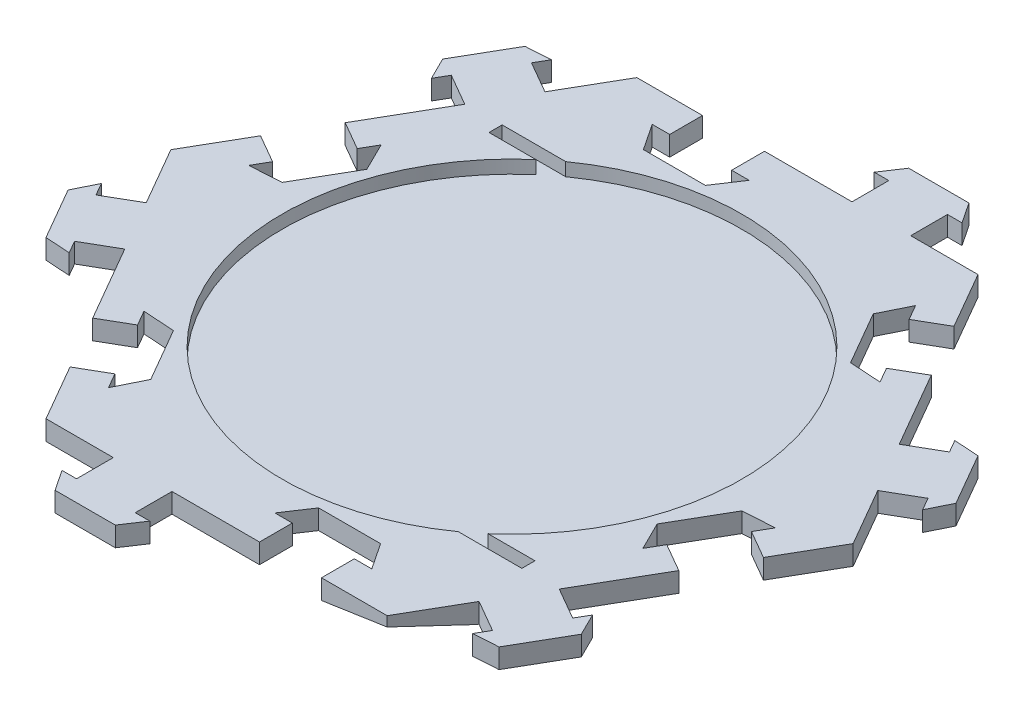
from build123d import *

# Parameters (mm, degrees)
SKETCH1_R               = 35
BOSS_EXTRUDE1_DEPTH     = 3
SKETCH1_3_R             = 35
BOSS_EXTRUDE2_DEPTH     = 1
SKETCH2_W               = 30
SKETCH2_H               = 2
CUT_EXTRUDE_THIN1_DEPTH = 10
CUT_EXTRUDE1_DEPTH      = 8.7
CUT_EXTRUDE1_DEPTH_BACK = 10


with BuildPart() as part:
    # Sketch1 → Boss-Extrude1 (new body)
    with BuildSketch(Plane(origin=(0, 0, 0), x_dir=(1, 0, 0), z_dir=(0, 1, 0))):
        Polygon((-15.980762114, 40), (-15.980762114, 45), (-25.980762114, 45), (-31.105762114, 36.123239611), (-35.955504375, 38.923239611), (-34.84856934, 40.840507331), (-38.62542222, 40.598806252), (-43.211790111, 32.654984042), (-41.532682946, 29.263282963), (-40.425747912, 31.180550683), (-35.576005651, 28.380550683), (-42.24128069, 16.835955668), (-37.911153671, 14.335955668), (-36.57925163, 16.642877674), (-34.447052056, 12.335955668), (-39.167295593, 4.160254038), (-43.963299249, 3.853332032), (-42.631397208, 6.160254038), (-46.961524227, 8.660254038), (-51.961524227, 0), (-46.836524227, -8.876760389), (-51.686266488, -11.676760389), (-52.793201523, -9.759492669), (-54.472308687, -13.151193748), (-49.885940796, -21.095015958), (-46.109087917, -21.336717037), (-47.216022951, -19.419449317), (-42.36628069, -16.619449317), (-35.701005651, -28.164044332), (-31.370878632, -25.664044332), (-32.702780673, -23.357122326), (-27.906777016, -23.664044332), (-23.186533479, -31.839745962), (-25.318733054, -36.146667968), (-26.650635095, -33.839745962), (-30.980762114, -36.339745962), (-25.980762114, -45), (-15.730762114, -45), (-15.730762114, -50.6), (-17.944632182, -50.6), (-15.846886468, -53.75), (-6.674150685, -53.75), (-4.576404971, -50.6), (-6.790275039, -50.6), (-6.790275039, -45), (6.540275039, -45), (6.540275039, -40), (3.876470958, -40), (6.540275039, -36), (15.980762114, -36), (18.644566195, -40), (15.980762114, -40), (15.980762114, -45), (25.980762114, -45), (31.105762114, -36.123239611), (35.955504375, -38.923239611), (34.84856934, -40.840507331), (38.62542222, -40.598806252), (43.211790111, -32.654984042), (41.532682946, -29.263282963), (40.425747912, -31.180550683), (35.576005651, -28.380550683), (42.24128069, -16.835955668), (37.911153671, -14.335955668), (36.57925163, -16.642877674), (34.447052056, -12.335955668), (39.167295593, -4.160254038), (43.963299249, -3.853332032), (42.631397208, -6.160254038), (46.961524227, -8.660254038), (51.961524227, 0), (46.836524227, 8.876760389), (51.686266488, 11.676760389), (52.793201523, 9.759492669), (54.472308687, 13.151193748), (49.885940796, 21.095015958), (46.109087917, 21.336717037), (47.216022951, 19.419449317), (42.36628069, 16.619449317), (35.701005651, 28.164044332), (31.370878632, 25.664044332), (32.702780673, 23.357122326), (27.906777016, 23.664044332), (23.186533479, 31.839745962), (25.318733054, 36.146667968), (26.650635095, 33.839745962), (30.980762114, 36.339745962), (25.980762114, 45), (15.730762114, 45), (15.730762114, 50.6), (17.944632182, 50.6), (15.846886468, 53.75), (6.674150685, 53.75), (4.576404971, 50.6), (6.790275039, 50.6), (6.790275039, 45), (-6.540275039, 45), (-6.540275039, 40), (-3.876470958, 40), (-6.540275039, 36), (-15.980762114, 36), (-18.644566195, 40), align=None)
        Circle(SKETCH1_R, mode=Mode.SUBTRACT)
    extrude(amount=BOSS_EXTRUDE1_DEPTH)

    # Sketch1<3> → Boss-Extrude2 (add)
    with BuildSketch(Plane(origin=(0, 0, 0), x_dir=(1, 0, 0), z_dir=(0, 1, 0))):
        Circle(SKETCH1_3_R)
    extrude(amount=BOSS_EXTRUDE2_DEPTH)

    # Sketch2 → Cut-Extrude-Thin1 (cut)
    with BuildSketch(Plane(origin=(0, 1, 0), x_dir=(1, 0, 0), z_dir=(0, 1, 0))):
        with Locations((-15, 27.5)):
            Rectangle(SKETCH2_W, SKETCH2_H)
        with Locations((15, -27.5)):
            Rectangle(SKETCH2_W, SKETCH2_H)
    extrude(amount=CUT_EXTRUDE_THIN1_DEPTH, mode=Mode.SUBTRACT)

    # Sketch4 → Cut-Extrude1 (cut, two sides: drawn at the far end of the back side and taken through both)
    with BuildSketch(Plane(origin=(0, 0, 0), x_dir=(-0.5000000000000003, 0, -0.8660254037844385), z_dir=(0.8660254037844386, 0, -0.5000000000000003)).offset(-CUT_EXTRUDE1_DEPTH_BACK)):
        Polygon((-51.961524227, 1.5), (-46.961524227, 0), (-51.961524227, 0), align=None)
    extrude(amount=CUT_EXTRUDE1_DEPTH + CUT_EXTRUDE1_DEPTH_BACK, mode=Mode.SUBTRACT)


solid = part.part
